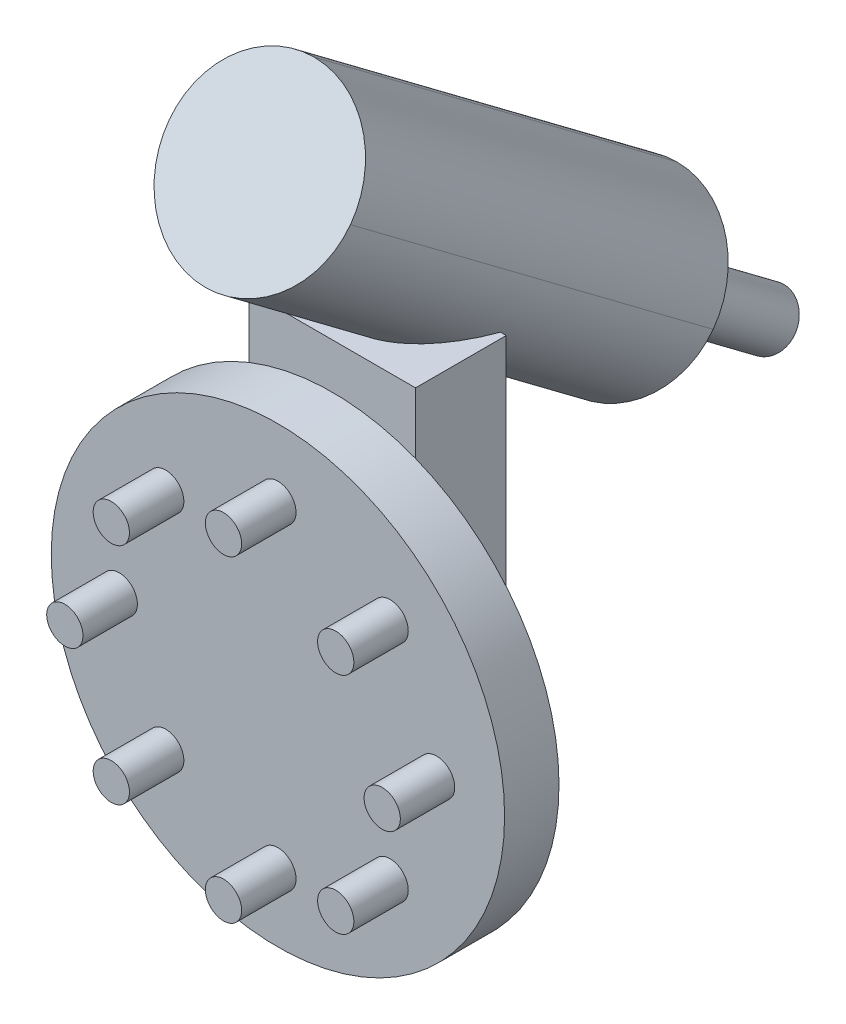
from build123d import *
from build123d.topology import SkipClean

# Parameters (mm, degrees)
SKIZZE2_R                       = 12.5
AUFSATZ_LINEAR_AUSTRAGEN1_DEPTH = 3
SKIZZE3_R                       = 1
AUFSATZ_LINEAR_AUSTRAGEN2_DEPTH = 3
SKIZZE4_W                       = 9.175781616
SKIZZE4_H                       = 15
AUFSATZ_LINEAR_AUSTRAGEN3_DEPTH = 5
SCHNITT_LINEAR_AUSTRAGEN1_DEPTH = 10
SKIZZE6_W                       = 10
SKIZZE6_H                       = 25
AUFSATZ_LINEAR_AUSTRAGEN4_DEPTH = 10
VERRUNDUNG1_R                   = 5
SKIZZE7_R                       = 1.5
AUFSATZ_LINEAR_AUSTRAGEN5_DEPTH = 10


with BuildPart() as part:
    # Skizze2 → Aufsatz-Linear austragen1 (new body)
    with BuildSketch(Plane.XY):
        Circle(SKIZZE2_R)
    extrude(amount=AUFSATZ_LINEAR_AUSTRAGEN1_DEPTH)

    # Skizze3 → Aufsatz-Linear austragen2 (add)
    with BuildSketch(Plane.XY.offset(3)):
        with Locations((0, 8.75)):
            Circle(SKIZZE3_R)
        with Locations((6.187184335, 6.187184335)):
            Circle(SKIZZE3_R)
        with Locations((8.75, 0)):
            Circle(SKIZZE3_R)
        with Locations((6.187184335, -6.187184335)):
            Circle(SKIZZE3_R)
        with Locations((0, -8.75)):
            Circle(SKIZZE3_R)
        with Locations((-6.187184335, -6.187184335)):
            Circle(SKIZZE3_R)
        with Locations((-8.75, 0)):
            Circle(SKIZZE3_R)
        with Locations((-6.187184335, 6.187184335)):
            Circle(SKIZZE3_R)
    extrude(amount=AUFSATZ_LINEAR_AUSTRAGEN2_DEPTH)

    # Skizze4 → Aufsatz-Linear austragen3 (add)
    with BuildSketch(Plane(origin=(0, 0, 0), x_dir=(-1, 0, 0), z_dir=(0, 0, -1))):
        with Locations((0, 7.5)):
            Rectangle(SKIZZE4_W, SKIZZE4_H)
    extrude(amount=AUFSATZ_LINEAR_AUSTRAGEN3_DEPTH)

    # Skizze5 → Schnitt-Linear austragen1 (cut)
    with BuildSketch(Plane(origin=(4.587890808, 0, 0), x_dir=(0, 0, -1), z_dir=(1, 0, 0))):
        Polygon((1, 15), (5, 15), (5, 12), align=None)
    extrude(amount=-SCHNITT_LINEAR_AUSTRAGEN1_DEPTH, mode=Mode.SUBTRACT)

    # Skizze6 → Aufsatz-Linear austragen4 (add)
    with BuildSketch(Plane(origin=(0, 10.08, -7.56), x_dir=(1, 0, 0), z_dir=(0, 0.8, -0.6000000000000001))):
        with Locations((0, -5.7)):
            Rectangle(SKIZZE6_W, SKIZZE6_H)
    extrude(amount=AUFSATZ_LINEAR_AUSTRAGEN4_DEPTH)

    # Verrundung1
    # the kernel refuses this fillet: 5 mm, written as the material it takes off along each edge
    with BuildSketch(Plane(origin=(5, 28.5, 17), x_dir=(0, 0.8, -0.6), z_dir=(0, -0.6000000000000001, -0.8))) as verrundung1_piece_1_section:
        with BuildLine():
            CenterArc((VERRUNDUNG1_R, -VERRUNDUNG1_R), VERRUNDUNG1_R, 90, 90)
            Line((0, -VERRUNDUNG1_R), (0, 0))
            Line((0, 0), (VERRUNDUNG1_R, 0))
        make_face()
    verrundung1_piece_1 = extrude(amount=50, mode=Mode.PRIVATE)
    verrundung1_piece_1 = split(verrundung1_piece_1, bisect_by=Plane(origin=(4.587890808, 18.932165371, 1.027012133), z_dir=(1, 0, 0)), keep=Keep.TOP, mode=Mode.PRIVATE)
    add(verrundung1_piece_1, mode=Mode.SUBTRACT)
    with BuildSketch(Plane(origin=(5, 28.5, 17), x_dir=(0, 0.8, -0.6), z_dir=(0, -0.6000000000000001, -0.8))) as verrundung1_piece_2_section:
        with BuildLine():
            CenterArc((VERRUNDUNG1_R, -VERRUNDUNG1_R), VERRUNDUNG1_R, 90, 90)
            Line((0, -VERRUNDUNG1_R), (0, 0))
            Line((0, 0), (VERRUNDUNG1_R, 0))
        make_face()
    verrundung1_piece_2 = extrude(amount=50, mode=Mode.PRIVATE)
    verrundung1_piece_2 = split(verrundung1_piece_2, bisect_by=Plane(origin=(3.559847319, 15, 2.011430888), z_dir=(0, 1, 0)), keep=Keep.TOP, mode=Mode.PRIVATE)
    add(verrundung1_piece_2, mode=Mode.SUBTRACT)
    with BuildSketch(Plane(origin=(5, 28.5, 17), x_dir=(0, 0.8, -0.6), z_dir=(0, -0.6000000000000001, -0.8))) as verrundung1_piece_3_section:
        with BuildLine():
            CenterArc((VERRUNDUNG1_R, -VERRUNDUNG1_R), VERRUNDUNG1_R, 90, 90)
            Line((0, -VERRUNDUNG1_R), (0, 0))
            Line((0, 0), (VERRUNDUNG1_R, 0))
        make_face()
    verrundung1_piece_3 = extrude(amount=50, mode=Mode.PRIVATE)
    verrundung1_piece_3 = split(verrundung1_piece_3, bisect_by=Plane(origin=(3.543313448, 9.872718636, -5), z_dir=(0, 0, -1)), keep=Keep.TOP, mode=Mode.PRIVATE)
    add(verrundung1_piece_3, mode=Mode.SUBTRACT)
    with BuildSketch(Plane(origin=(-5, -1.5, -23), x_dir=(0, 0.7999999999999999, -0.6000000000000001), z_dir=(0, 0.6000000000000001, 0.8))) as verrundung1_piece_4_section:
        with BuildLine():
            CenterArc((VERRUNDUNG1_R, -VERRUNDUNG1_R), VERRUNDUNG1_R, 90, 90)
            Line((0, -VERRUNDUNG1_R), (0, 0))
            Line((0, 0), (VERRUNDUNG1_R, 0))
        make_face()
    verrundung1_piece_4 = extrude(amount=50, mode=Mode.PRIVATE)
    verrundung1_piece_4 = split(verrundung1_piece_4, bisect_by=Plane(origin=(-4.807563365, 10.769431466, -5), z_dir=(0, 0, -1)), keep=Keep.TOP, mode=Mode.PRIVATE)
    add(verrundung1_piece_4, mode=Mode.SUBTRACT)
    with BuildSketch(Plane(origin=(-5, -1.5, -23), x_dir=(0, 0.7999999999999999, -0.6000000000000001), z_dir=(0, 0.6000000000000001, 0.8))) as verrundung1_piece_5_section:
        with BuildLine():
            CenterArc((VERRUNDUNG1_R, -VERRUNDUNG1_R), VERRUNDUNG1_R, 90, 90)
            Line((0, -VERRUNDUNG1_R), (0, 0))
            Line((0, 0), (VERRUNDUNG1_R, 0))
        make_face()
    verrundung1_piece_5 = extrude(amount=50, mode=Mode.PRIVATE)
    verrundung1_piece_5 = split(verrundung1_piece_5, bisect_by=Plane(origin=(-4.587890808, 14, -3.666666667), z_dir=(-1, 0, 0)), keep=Keep.TOP, mode=Mode.PRIVATE)
    add(verrundung1_piece_5, mode=Mode.SUBTRACT)
    with BuildSketch(Plane(origin=(-5, -1.5, -23), x_dir=(0, 0.7999999999999999, -0.6000000000000001), z_dir=(0, 0.6000000000000001, 0.8))) as verrundung1_piece_6_section:
        with BuildLine():
            CenterArc((VERRUNDUNG1_R, -VERRUNDUNG1_R), VERRUNDUNG1_R, 90, 90)
            Line((0, -VERRUNDUNG1_R), (0, 0))
            Line((0, 0), (VERRUNDUNG1_R, 0))
        make_face()
    verrundung1_piece_6 = extrude(amount=50, mode=Mode.PRIVATE)
    verrundung1_piece_6 = split(verrundung1_piece_6, bisect_by=Plane(origin=(-3.559847319, 15, 2.011430888), z_dir=(0, 1, 0)), keep=Keep.TOP, mode=Mode.PRIVATE)
    add(verrundung1_piece_6, mode=Mode.SUBTRACT)
    with BuildSketch(Plane(origin=(-5, 6.5, -29), x_dir=(0, -0.8, 0.6), z_dir=(0, 0.6000000000000001, 0.8)), Plane(origin=(5, 36.5, 11), x_dir=(0, -0.8, 0.6), z_dir=(0, -0.6000000000000001, -0.8))) as verrundung1_piece_7:
        with BuildLine():
            CenterArc((VERRUNDUNG1_R, VERRUNDUNG1_R), VERRUNDUNG1_R, 180, 90)
            Line((0, VERRUNDUNG1_R), (0, 0))
            Line((0, 0), (VERRUNDUNG1_R, 0))
        make_face()
    extrude(amount=50, mode=Mode.SUBTRACT)

    # Skizze7 → Aufsatz-Linear austragen5 (add)
    with SkipClean():  # the faces are left unmerged after this step: merging them gives an invalid solid
        with BuildSketch(Plane(origin=(0, -4.08, -5.44), x_dir=(-1, 0, 0), z_dir=(0, -0.6000000000000002, -0.7999999999999999))):
            with Locations(Location((0, 17.6, 0), (0, 0, 90))):
                Circle(SKIZZE7_R)
        extrude(amount=AUFSATZ_LINEAR_AUSTRAGEN5_DEPTH)


solid = part.part
